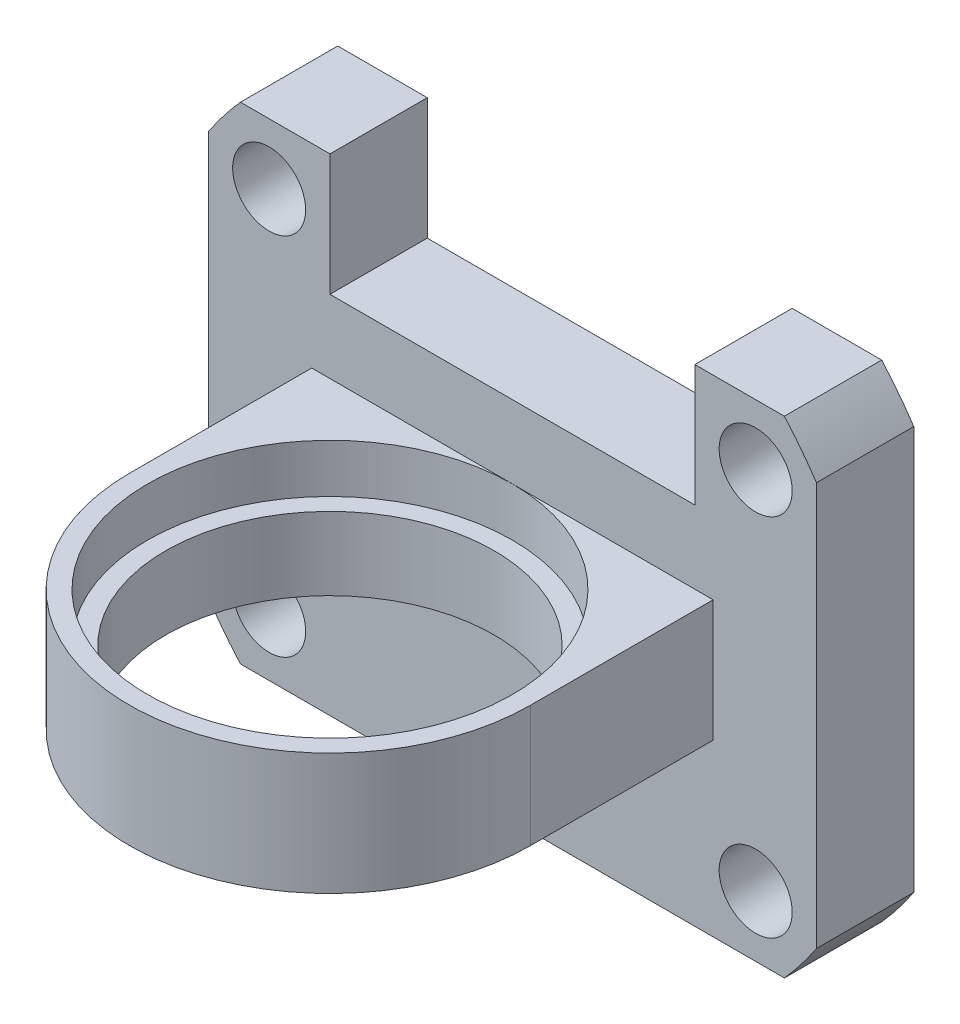
from build123d import *

# Parameters (mm, degrees)
BOSS_EXTRUDE1_DEPTH     = 8
CUT_EXTRUDE4_DEPTH      = 34
CUT_EXTRUDE4_DEPTH_BACK = 34
SKETCH2_R               = 3
SKETCH3_R               = 15
BOSS_EXTRUDE2_DEPTH     = 4
BOSS_EXTRUDE4_START     = -6
SKETCH3_5_R             = 15
SKETCH3_5_R_2           = 13.5
BOSS_EXTRUDE4_DEPTH     = 6
CUT_EXTRUDE5_DEPTH      = 8


# Read off the part's stored shape, not the designer's step: Cut-Extrude5
with BuildPart() as part:
    # Sketch1 → Boss-Extrude1 (new body)
    with BuildSketch(Plane.XY):
        Polygon((-25, -20), (25, -20), (25, 20), (15, 20), (15, 10), (-15, 10), (-15, 20), (-25, 20), align=None)
    extrude(amount=BOSS_EXTRUDE1_DEPTH)

    # Sketch2 → Cut-Extrude4 (cut, two sides: drawn at the far end of the back side and taken through both)
    with BuildSketch(Plane.XY.offset(-CUT_EXTRUDE4_DEPTH_BACK)):
        with Locations((-20, 15)):
            Circle(SKETCH2_R)
        with Locations((-20, -15)):
            Circle(SKETCH2_R)
        with Locations((20, -15)):
            Circle(SKETCH2_R)
        with Locations((20, 15)):
            Circle(SKETCH2_R)
    extrude(amount=CUT_EXTRUDE4_DEPTH + CUT_EXTRUDE4_DEPTH_BACK, mode=Mode.SUBTRACT)

    # Sketch3 → Boss-Extrude2 (add)
    with BuildSketch(Plane(origin=(0, 0, 0), x_dir=(1, 0, 0), z_dir=(0, 1, 0))):
        with BuildLine():
            Line((-16.5, -23), (-16.5, -7))
            Line((-16.5, -7), (16.5, -7))
            Line((16.5, -7), (16.5, -23))
            ThreePointArc((16.5, -23), (0, -39.5), (-16.5, -23))
        make_face()
        with Locations(Location((0, -23, 0), (0, 0, 90))):
            Circle(SKETCH3_R, mode=Mode.SUBTRACT)
    extrude(amount=BOSS_EXTRUDE2_DEPTH)

    # Sketch3<5> → Boss-Extrude4 (add)
    # profile 1 of 2: a face of its own
    with BuildSketch(Plane(origin=(0, 0, 0), x_dir=(1, 0, 0), z_dir=(0, 1, 0)).offset(BOSS_EXTRUDE4_START)):
        with BuildLine():
            Line((-16.5, -23), (-16.5, -7))
            Line((-16.5, -7), (16.5, -7))
            Line((16.5, -7), (16.5, -23))
            ThreePointArc((16.5, -23), (0, -39.5), (-16.5, -23))
        make_face()
        with Locations(Location((0, -23, 0), (0, 0, 90))):
            Circle(SKETCH3_5_R, mode=Mode.SUBTRACT)
    # profile 2 of 2: a face of its own
    with BuildSketch(Plane(origin=(0, 0, 0), x_dir=(1, 0, 0), z_dir=(0, 1, 0)).offset(BOSS_EXTRUDE4_START)):
        with Locations(Location((0, -23, 0), (0, 0, 90))):
            Circle(SKETCH3_5_R)
        with Locations(Location((0, -23, 0), (0, 0, 270))):
            Circle(SKETCH3_5_R_2, mode=Mode.SUBTRACT)
    extrude(amount=BOSS_EXTRUDE4_DEPTH)

    # Cut-Extrude5 outline → Cut-Extrude5 (cut)
    with BuildSketch(Plane.XY):
        with BuildLine():
            Line((25, 20), (22.360679775, 20))
            ThreePointArc((22.360679775, 20), (23.74188825, 18.339104186), (25, 16.583123952))
            Line((25, 16.583123952), (25, 20))
        make_face()
        with BuildLine():
            Line((-25, 20), (-25, 16.583123952))
            ThreePointArc((-25, 16.583123952), (-23.74188825, 18.339104186), (-22.360679775, 20))
            Line((-22.360679775, 20), (-25, 20))
        make_face()
        with BuildLine():
            Line((-25, -20), (-22.360679775, -20))
            ThreePointArc((-22.360679775, -20), (-23.74188825, -18.339104186), (-25, -16.583123952))
            Line((-25, -16.583123952), (-25, -20))
        make_face()
        with BuildLine():
            Line((25, -20), (25, -16.583123952))
            ThreePointArc((25, -16.583123952), (23.74188825, -18.339104186), (22.360679775, -20))
            Line((22.360679775, -20), (25, -20))
        make_face()
    extrude(amount=CUT_EXTRUDE5_DEPTH, mode=Mode.SUBTRACT)


solid = part.part
